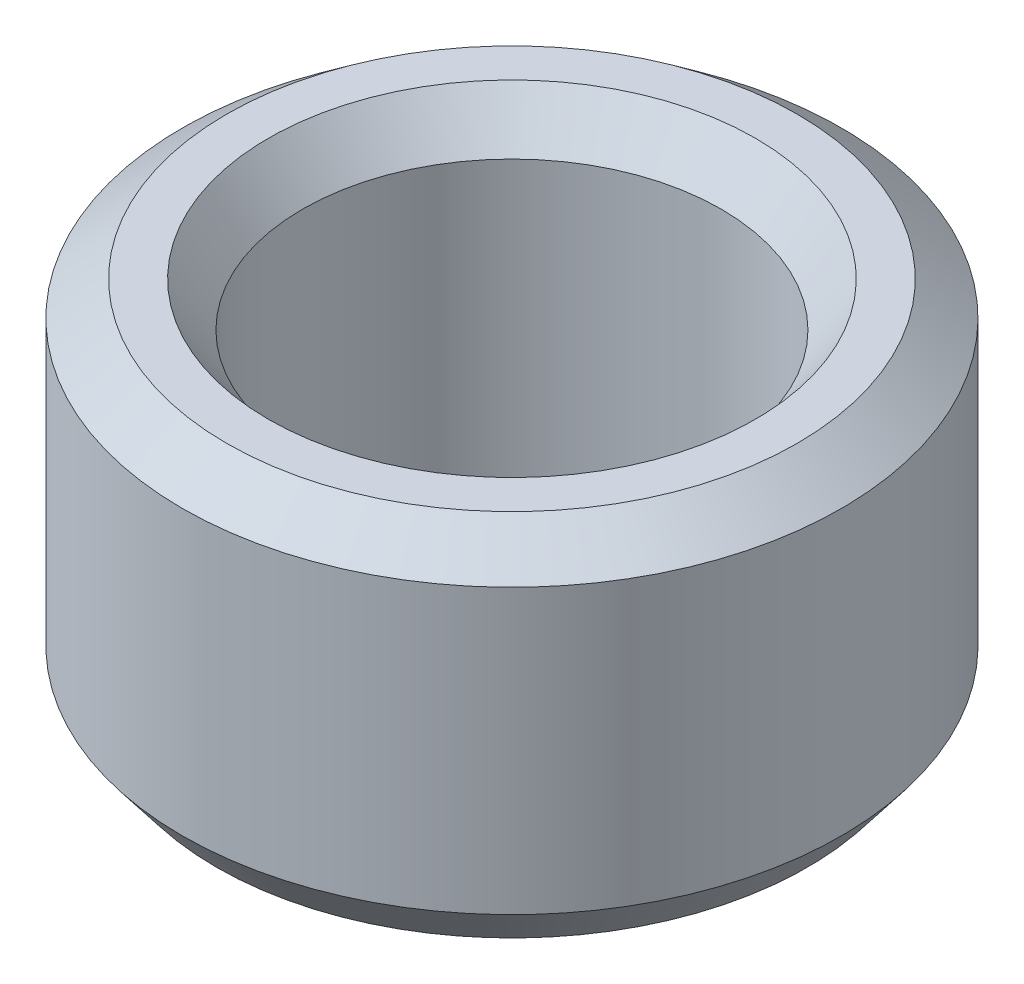
from build123d import *
from OCP.BRepFilletAPI import BRepFilletAPI_MakeChamfer

# Parameters (mm, degrees)
SKETCH1_R           = 37.5
BOSS_EXTRUDE1_DEPTH = 41.193797117
SKETCH2_R           = 23.818961457
CUT_EXTRUDE1_DEPTH  = 68.152281576
CHAMFER1_SIZE       = 3.886228809
CHAMFER1_SIZE2      = 5.0460955


with BuildPart() as part:
    # Sketch1 → Boss-Extrude1 (new body)
    with BuildSketch(Plane(origin=(0, 0, 0), x_dir=(1, 0, 0), z_dir=(0, 1, 0))):
        Circle(SKETCH1_R)
    extrude(amount=BOSS_EXTRUDE1_DEPTH)

    # Sketch2 → Cut-Extrude1 (cut, through all)
    with BuildSketch(Plane(origin=(0, 0, 0), x_dir=(1, 0, 0), z_dir=(0, 1, 0))):
        Circle(SKETCH2_R)
    extrude(amount=CUT_EXTRUDE1_DEPTH, mode=Mode.SUBTRACT)

    # Chamfer1: one chamfer whose edges measure the first distance from different faces: ONE call of the kernel's chamfer builder (chamfer() names one face for all edges)
    chamfer1_edges_1 = [part.edges().sort_by_distance(p)[0] for p in [
        (-23.818961457, 41.193797117, 0),
    ]]
    chamfer1_side_1 = [part.faces().sort_by_distance(p)[0] for p in [
        (-36.439339828, 41.193797117, 0),
    ]]
    chamfer1_edges_2 = [part.edges().sort_by_distance(p)[0] for p in [
        (-23.818961457, 0, 0),
    ]]
    chamfer1_side_2 = [part.faces().sort_by_distance(p)[0] for p in [
        (-23.818961457, 20.596898558, 0),
    ]]
    chamfer1_edges_3 = [part.edges().sort_by_distance(p)[0] for p in [
        (-37.5, 0, 0),
    ]]
    chamfer1_side_3 = [part.faces().sort_by_distance(p)[0] for p in [
        (-36.439339828, 0, 0),
    ]]
    chamfer1_edges_4 = [part.edges().sort_by_distance(p)[0] for p in [
        (-37.5, 41.193797117, 0),
    ]]
    chamfer1_side_4 = [part.faces().sort_by_distance(p)[0] for p in [
        (-37.5, 20.596898558, 0),
    ]]
    chamfer1 = BRepFilletAPI_MakeChamfer(part.part.solid().wrapped)
    for e in chamfer1_edges_1:
        chamfer1.Add(CHAMFER1_SIZE, CHAMFER1_SIZE2, e.wrapped, chamfer1_side_1[0].wrapped)  # the first distance lies on this face
    for e in chamfer1_edges_2:
        chamfer1.Add(CHAMFER1_SIZE, CHAMFER1_SIZE2, e.wrapped, chamfer1_side_2[0].wrapped)  # the first distance lies on this face
    for e in chamfer1_edges_3:
        chamfer1.Add(CHAMFER1_SIZE, CHAMFER1_SIZE2, e.wrapped, chamfer1_side_3[0].wrapped)  # the first distance lies on this face
    for e in chamfer1_edges_4:
        chamfer1.Add(CHAMFER1_SIZE, CHAMFER1_SIZE2, e.wrapped, chamfer1_side_4[0].wrapped)  # the first distance lies on this face
    add(Compound.cast(chamfer1.Shape()), mode=Mode.REPLACE)


solid = part.part
